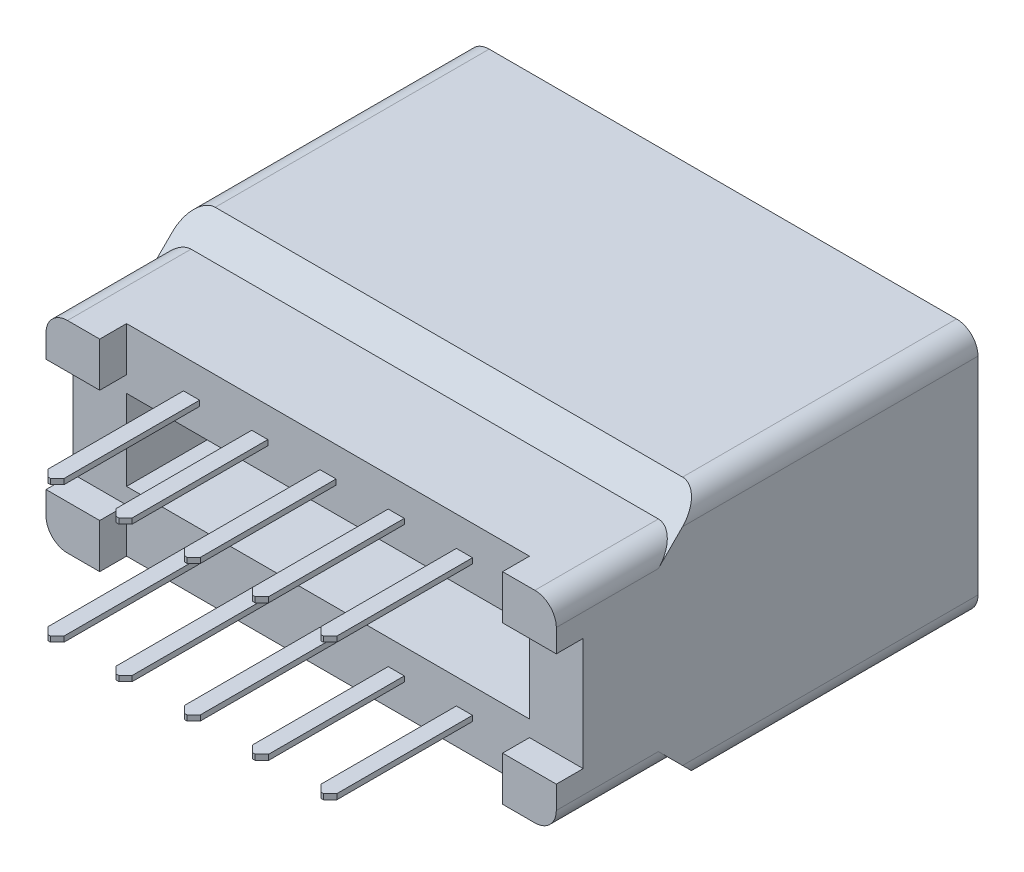
from build123d import *
from OCP.BRepFilletAPI import BRepFilletAPI_MakeChamfer

# Parameters (mm, degrees)
SKETCH_1_W          = 19
SKETCH_1_H          = 9.3
EXTRUDE_1_DEPTH     = 10.2
SKETCH_2_W          = 19
SKETCH_2_H          = 7.5
EXTRUDE_2_DEPTH     = 5.5
SKETCH_3_W          = 19
SKETCH_3_H          = 4.2
CUT_EXTRUDE_1_DEPTH = 1
SKETCH_4_W          = 15
SKETCH_4_H          = 7.5
CUT_EXTRUDE_2_DEPTH = 1
CHAMFER_1_SIZE      = 0.9
SKETCH_5_W          = 15
SKETCH_5_H          = 3
CUT_EXTRUDE_3_DEPTH = 3.5
SKETCH_6_W          = 0.6
SKETCH_6_H          = 0.2
EXTRUDE_3_DEPTH     = 5.3
CHAMFER_2_SIZE      = 0.25
SKETCH_7_W          = 15.6
SKETCH_7_H          = 1.9
CUT_EXTRUDE_4_DEPTH = 8.8
CHAMFER_3_SIZE      = 1.4
CHAMFER_3_SIZE2     = 1.093799877
SKETCH_8_W          = 1.6
SKETCH_8_H          = 7.3
CUT_EXTRUDE_5_DEPTH = 8.8
SKETCH_9_W          = 2.3
SKETCH_9_H          = 1.606200123
CUT_EXTRUDE_6_DEPTH = 8.8
FILLET_1_R          = 0.8
SKETCH_10_W         = 1.8
SKETCH_10_H         = 1.3
CUT_EXTRUDE_7_DEPTH = 8.8


with BuildPart() as part:
    # Эскиз1 → Бобышка-Вытянуть1 (new body)
    with BuildSketch(Plane.XY):
        Rectangle(SKETCH_1_W, SKETCH_1_H)
    extrude(amount=EXTRUDE_1_DEPTH)

    # Эскиз2 → Бобышка-Вытянуть2 (add)
    with BuildSketch(Plane.XY.offset(10.2)):
        Rectangle(SKETCH_2_W, SKETCH_2_H)
    extrude(amount=EXTRUDE_2_DEPTH)

    # Эскиз3 → Вырез-Вытянуть1 (cut)
    with BuildSketch(Plane.XY.offset(15.7)):
        Rectangle(SKETCH_3_W, SKETCH_3_H)
    extrude(amount=-CUT_EXTRUDE_1_DEPTH, mode=Mode.SUBTRACT)

    # Эскиз4 → Вырез-Вытянуть2 (cut)
    with BuildSketch(Plane.XY.offset(15.7)):
        Rectangle(SKETCH_4_W, SKETCH_4_H)
    extrude(amount=-CUT_EXTRUDE_2_DEPTH, mode=Mode.SUBTRACT)

    # Фаска1
    chamfer_1_edges = [part.edges().sort_by_distance(p)[0] for p in [
        (0, -3.75, 10.2),
        (0, 3.75, 10.2),
    ]]
    chamfer(chamfer_1_edges, length=CHAMFER_1_SIZE - 0.0001)  # a hair under: the kernel refuses the full size

    # Эскиз5 → Вырез-Вытянуть3 (cut)
    with BuildSketch(Plane.XY.offset(14.7)):
        Rectangle(SKETCH_5_W, SKETCH_5_H)
    extrude(amount=-CUT_EXTRUDE_3_DEPTH, mode=Mode.SUBTRACT)

    # Эскиз6 → Бобышка-Вытянуть3 (add)
    with BuildSketch(Plane.XY.offset(14.7)):
        with Locations((-5.08, 2.54)):
            Rectangle(SKETCH_6_W, SKETCH_6_H)
        with Locations((-2.54, 2.54)):
            Rectangle(SKETCH_6_W, SKETCH_6_H)
        with Locations((0, 2.54)):
            Rectangle(SKETCH_6_W, SKETCH_6_H)
        with Locations((2.54, 2.54)):
            Rectangle(SKETCH_6_W, SKETCH_6_H)
        with Locations((5.08, 2.54)):
            Rectangle(SKETCH_6_W, SKETCH_6_H)
        with Locations((-5.08, -2.54)):
            Rectangle(SKETCH_6_W, SKETCH_6_H)
        with Locations((-2.54, -2.54)):
            Rectangle(SKETCH_6_W, SKETCH_6_H)
        with Locations((0, -2.54)):
            Rectangle(SKETCH_6_W, SKETCH_6_H)
        with Locations((2.54, -2.54)):
            Rectangle(SKETCH_6_W, SKETCH_6_H)
        with Locations((5.08, -2.54)):
            Rectangle(SKETCH_6_W, SKETCH_6_H)
    extrude(amount=EXTRUDE_3_DEPTH)

    # Фаска2
    chamfer_2_edges = [part.edges().sort_by_distance(p)[0] for p in [
        (-4.78, 2.54, 20),
        (-5.38, 2.54, 20),
        (-2.24, 2.54, 20),
        (-2.84, 2.54, 20),
        (0.3, 2.54, 20),
        (-0.3, 2.54, 20),
        (2.84, 2.54, 20),
        (2.24, 2.54, 20),
        (5.38, 2.54, 20),
        (4.78, 2.54, 20),
        (-4.78, -2.54, 20),
        (-5.38, -2.54, 20),
        (-2.24, -2.54, 20),
        (-2.84, -2.54, 20),
        (0.3, -2.54, 20),
        (-0.3, -2.54, 20),
        (2.84, -2.54, 20),
        (2.24, -2.54, 20),
        (5.38, -2.54, 20),
        (4.78, -2.54, 20),
    ]]
    chamfer(chamfer_2_edges, length=CHAMFER_2_SIZE)

    # Эскиз7 → Вырез-Вытянуть4 (cut)
    with BuildSketch(Plane(origin=(0, 0, 0), x_dir=(-1, 0, 0), z_dir=(0, 0, -1))):
        Rectangle(SKETCH_7_W, SKETCH_7_H)
    extrude(amount=-CUT_EXTRUDE_4_DEPTH, mode=Mode.SUBTRACT)

    # Фаска3: one chamfer whose edges measure the first distance from different faces: ONE call of the kernel's chamfer builder (chamfer() names one face for all edges)
    chamfer_3_edges_1 = [part.edges().sort_by_distance(p)[0] for p in [
        (7.8, 0, 0),
    ]]
    chamfer_3_side_1 = [part.faces().sort_by_distance(p)[0] for p in [
        (7.8, 0, 4.4),
    ]]
    chamfer_3_edges_2 = [part.edges().sort_by_distance(p)[0] for p in [
        (0, -0.95, 0),
    ]]
    chamfer_3_side_2 = [part.faces().sort_by_distance(p)[0] for p in [
        (0, -0.95, 4.4),
    ]]
    chamfer_3_edges_3 = [part.edges().sort_by_distance(p)[0] for p in [
        (-7.8, 0, 0),
    ]]
    chamfer_3_side_3 = [part.faces().sort_by_distance(p)[0] for p in [
        (-7.8, 0, 4.4),
    ]]
    chamfer_3_edges_4 = [part.edges().sort_by_distance(p)[0] for p in [
        (0, 0.95, 0),
    ]]
    chamfer_3_side_4 = [part.faces().sort_by_distance(p)[0] for p in [
        (0, 0.95, 4.4),
    ]]
    chamfer_3 = BRepFilletAPI_MakeChamfer(part.part.solid().wrapped)
    for e in chamfer_3_edges_1:
        chamfer_3.Add(CHAMFER_3_SIZE, CHAMFER_3_SIZE2, e.wrapped, chamfer_3_side_1[0].wrapped)  # the first distance lies on this face
    for e in chamfer_3_edges_2:
        chamfer_3.Add(CHAMFER_3_SIZE, CHAMFER_3_SIZE2, e.wrapped, chamfer_3_side_2[0].wrapped)  # the first distance lies on this face
    for e in chamfer_3_edges_3:
        chamfer_3.Add(CHAMFER_3_SIZE, CHAMFER_3_SIZE2, e.wrapped, chamfer_3_side_3[0].wrapped)  # the first distance lies on this face
    for e in chamfer_3_edges_4:
        chamfer_3.Add(CHAMFER_3_SIZE, CHAMFER_3_SIZE2, e.wrapped, chamfer_3_side_4[0].wrapped)  # the first distance lies on this face
    add(Compound.cast(chamfer_3.Shape()), mode=Mode.REPLACE)

    # Эскиз8 → Вырез-Вытянуть5 (cut)
    with BuildSketch(Plane(origin=(0, 0, 0), x_dir=(-1, 0, 0), z_dir=(0, 0, -1))):
        with Locations((2.54, 0)):
            Rectangle(SKETCH_8_W, SKETCH_8_H)
        Rectangle(SKETCH_8_W, SKETCH_8_H)
        with Locations((5.08, 0)):
            Rectangle(SKETCH_8_W, SKETCH_8_H)
        with Locations((-2.54, 0)):
            Rectangle(SKETCH_8_W, SKETCH_8_H)
        with Locations((-5.08, 0)):
            Rectangle(SKETCH_8_W, SKETCH_8_H)
    extrude(amount=-CUT_EXTRUDE_5_DEPTH, mode=Mode.SUBTRACT)

    # Эскиз9 → Вырез-Вытянуть6 (cut)
    with BuildSketch(Plane(origin=(0, 0, 0), x_dir=(-1, 0, 0), z_dir=(0, 0, -1))):
        with Locations((-5.08, 3.046899939)):
            Rectangle(SKETCH_9_W, SKETCH_9_H)
        with Locations((-2.54, 3.046899939)):
            Rectangle(SKETCH_9_W, SKETCH_9_H)
        with Locations((0, 3.046899939)):
            Rectangle(SKETCH_9_W, SKETCH_9_H)
        with Locations((2.54, 3.046899939)):
            Rectangle(SKETCH_9_W, SKETCH_9_H)
        with Locations((5.08, 3.046899939)):
            Rectangle(SKETCH_9_W, SKETCH_9_H)
        with Locations((-2.54, -3.053100062)):
            Rectangle(SKETCH_9_W, SKETCH_9_H)
        with Locations((0, -3.053100062)):
            Rectangle(SKETCH_9_W, SKETCH_9_H)
        with Locations((2.54, -3.053100062)):
            Rectangle(SKETCH_9_W, SKETCH_9_H)
        with Locations((5.08, -3.053100062)):
            Rectangle(SKETCH_9_W, SKETCH_9_H)
        with Locations((-5.08, -3.053100062)):
            Rectangle(SKETCH_9_W, SKETCH_9_H)
    extrude(amount=-CUT_EXTRUDE_6_DEPTH, mode=Mode.SUBTRACT)

    # Скругление1
    fillet_1_edges = [part.edges().sort_by_distance(p)[0] for p in [
        (-9.5, 3.75, 13.39995),
        (-9.5, -3.75, 13.39995),
        (9.5, -3.75, 13.39995),
        (9.5, 3.75, 13.39995),
        (-9.5, 4.65, 5.1),
        (9.5, 4.65, 5.1),
        (9.5, -4.65, 5.1),
        (-9.5, -4.65, 5.1),
    ]]
    fillet(fillet_1_edges, radius=FILLET_1_R)

    # Эскиз10 → Вырез-Вытянуть7 (cut)
    with BuildSketch(Plane(origin=(0, 0, 0), x_dir=(-1, 0, 0), z_dir=(0, 0, -1))):
        with Locations((-8.2, 3.1)):
            Rectangle(SKETCH_10_W, SKETCH_10_H)
        with Locations((8.2, 3.1)):
            Rectangle(SKETCH_10_W, SKETCH_10_H)
        with Locations((8.2, -3.1)):
            Rectangle(SKETCH_10_W, SKETCH_10_H)
        with Locations((-8.2, -3.1)):
            Rectangle(SKETCH_10_W, SKETCH_10_H)
    extrude(amount=-CUT_EXTRUDE_7_DEPTH, mode=Mode.SUBTRACT)


solid = part.part
